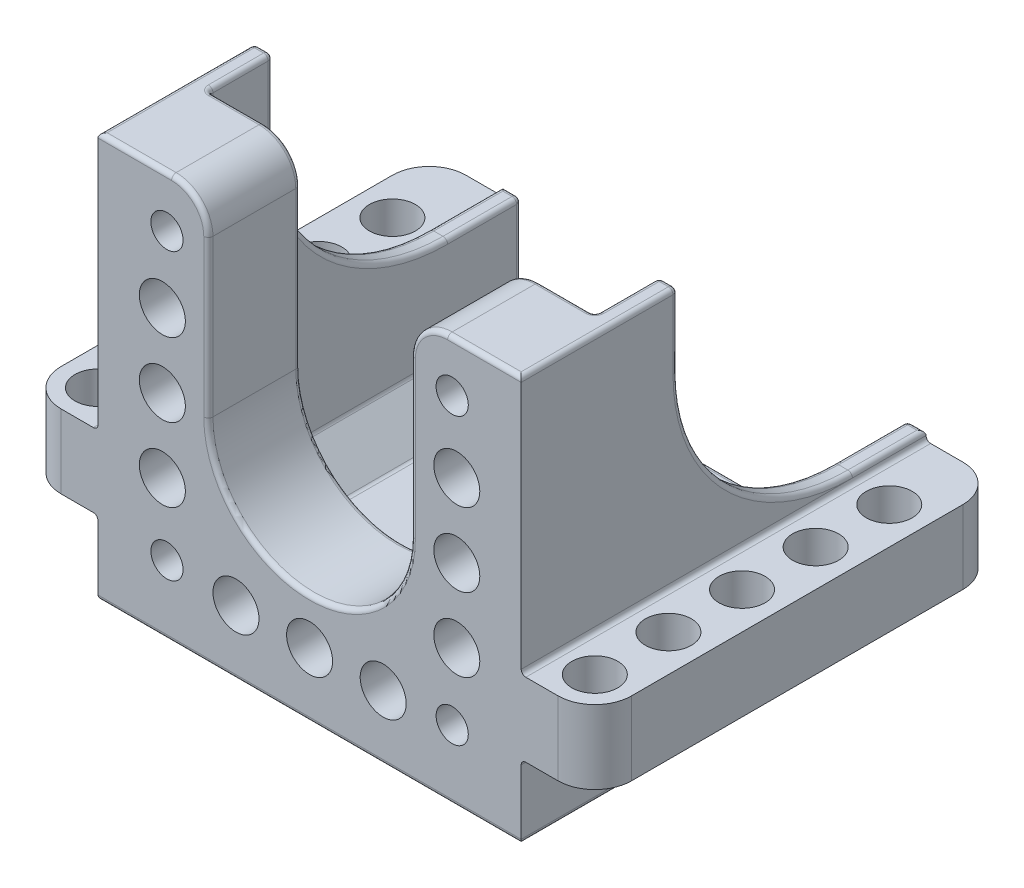
from build123d import *

# Parameters (mm, degrees)
SKETCH1_R           = 2.5
SKETCH1_R_2         = 1.75
BOSS_EXTRUDE1_DEPTH = 10
BOSS_EXTRUDE2_DEPTH = 34
CUT_EXTRUDE1_DEPTH  = 62.652250567
SKETCH3_3_W         = 44
SKETCH3_3_H         = 8
BOSS_EXTRUDE3_DEPTH = 8
SKETCH4_R           = 2.5
CUT_EXTRUDE2_DEPTH  = 54.860932038
CHAMFER1_SIZE       = 4
FILLET1_R           = 0.5
FILLET2_R           = 4


# Some blends are built 0.0001 mm under size
with BuildPart() as part:
    # Sketch1 → Boss-Extrude1 (new body)
    # profile 1 of 2: a face of its own
    with BuildSketch(Plane.XY):
        with BuildLine():
            ThreePointArc((-11, 0), (0, -11), (11, 0))
            Line((11, 0), (11, 21))
            Line((11, 21), (21, 21))
            Line((21, 21), (21, -21))
            Line((21, -21), (-21, -21))
            Line((-21, -21), (-21, 21))
            Line((-21, 21), (-11, 21))
            Line((-11, 21), (-11, 0))
        make_face()
        with Locations((-16, 8)):
            Circle(SKETCH1_R, mode=Mode.SUBTRACT)
        with Locations((-16, -8)):
            Circle(SKETCH1_R, mode=Mode.SUBTRACT)
        with Locations((-8, -16)):
            Circle(SKETCH1_R, mode=Mode.SUBTRACT)
        with Locations((8, -16)):
            Circle(SKETCH1_R, mode=Mode.SUBTRACT)
        with Locations((16, -8)):
            Circle(SKETCH1_R, mode=Mode.SUBTRACT)
        with Locations((16, 8)):
            Circle(SKETCH1_R, mode=Mode.SUBTRACT)
        with Locations((0, -16)):
            Circle(SKETCH1_R, mode=Mode.SUBTRACT)
        with Locations((-16, 0)):
            Circle(SKETCH1_R, mode=Mode.SUBTRACT)
        with Locations((16, 0)):
            Circle(SKETCH1_R, mode=Mode.SUBTRACT)
        with Locations((15.5, -15.5)):
            Circle(SKETCH1_R_2, mode=Mode.SUBTRACT)
        with Locations((15.5, 15.5)):
            Circle(SKETCH1_R_2, mode=Mode.SUBTRACT)
        with Locations((-15.5, 15.5)):
            Circle(SKETCH1_R_2, mode=Mode.SUBTRACT)
        with Locations((-15.5, -15.5)):
            Circle(SKETCH1_R_2, mode=Mode.SUBTRACT)
    # profile 2 of 2: a face of its own
    with BuildSketch(Plane.XY):
        Polygon((-23, 21), (-21, 21), (-21, -21), (21, -21), (21, 21), (23, 21), (23, -23), (-23, -23), align=None)
    extrude(amount=BOSS_EXTRUDE1_DEPTH)

    # Sketch1<3> → Boss-Extrude2 (add)
    with BuildSketch(Plane.XY):
        Polygon((-23, 21), (-21, 21), (-21, -21), (21, -21), (21, 21), (23, 21), (23, -23), (-23, -23), align=None)
    extrude(amount=-BOSS_EXTRUDE2_DEPTH)

    # Sketch3 → Cut-Extrude1 (cut, through all)
    with BuildSketch(Plane(origin=(23, 0, 0), x_dir=(0, 0, -1), z_dir=(1, 0, 0))):
        with BuildLine():
            Line((34, 21), (7, 21))
            Line((7, 21), (7, 13))
            ThreePointArc((7, 13), (12.564971157, -0.435028843), (26, -6))
            Line((26, -6), (34, -6))
            Line((34, -6), (34, 21))
        make_face()
    extrude(amount=-CUT_EXTRUDE1_DEPTH, mode=Mode.SUBTRACT)

    # Sketch3<3> → Boss-Extrude3 (add)
    with BuildSketch(Plane(origin=(23, 0, 0), x_dir=(0, 0, -1), z_dir=(1, 0, 0))):
        with Locations((12, -11)):
            Rectangle(SKETCH3_3_W, SKETCH3_3_H)
    boss_extrude3 = extrude(amount=BOSS_EXTRUDE3_DEPTH)

    # Sketch4 → Cut-Extrude2 (cut, through all)
    with BuildSketch(Plane(origin=(0, -7, 0), x_dir=(1, 0, 0), z_dir=(0, 1, 0))):
        with Locations(Location((27, -5.998987859, 0), (0, 0, 180))):
            Circle(SKETCH4_R)
        with Locations(Location((27, 2.001012141, 0), (0, 0, 180))):
            Circle(SKETCH4_R)
        with Locations(Location((27, 10.001012141, 0), (0, 0, 180))):
            Circle(SKETCH4_R)
        with Locations(Location((27, 18.001012141, 0), (0, 0, 180))):
            Circle(SKETCH4_R)
        with Locations(Location((27, 26.001012141, 0), (0, 0, 180))):
            Circle(SKETCH4_R)
    cut_extrude2 = extrude(amount=-CUT_EXTRUDE2_DEPTH, mode=Mode.SUBTRACT)

    # Mirror1: Boss-Extrude3, Cut-Extrude2 across plane
    add(boss_extrude3.mirror(Plane(origin=(0, 0, 0), x_dir=(0, 0, 1), z_dir=(1, 0, 0))))
    add(cut_extrude2.mirror(Plane(origin=(0, 0, 0), x_dir=(0, 0, 1), z_dir=(1, 0, 0))), mode=Mode.SUBTRACT)

    # Chamfer1
    chamfer1_edges = [part.edges().sort_by_distance(p)[0] for p in [
        (-21, -21, -17),
        (21, -21, -17),
    ]]
    chamfer(chamfer1_edges, length=CHAMFER1_SIZE)

    # Fillet1
    fillet1_edges = [part.edges().sort_by_distance(p)[0] for p in [
        (-21, 21, -3.5),
        (21, 21, -3.5),
        (-11, 10.5, 10),
        (0, -11, 10),
        (-11, 10.5, 0),
        (0, -11, 0),
        (-23, 17, -7),
        (-23, -6, -30),
        (-21, -6, -30),
        (-21, -0.435028843, -12.564971157),
        (23, 17, -7),
        (23, -6, -30),
        (21, 17, -7),
        (21, -6, -30),
        (0, -23, 10),
        (23, -23, -12),
        (0, -23, -34),
        (-23, -23, -12),
        (0, -21, -34),
        (0, -21, 0),
        (-21, -11.5, -34),
        (21, -11.5, -34),
        (-23, -15, -12),
        (23, -15, -12),
        (11, 10.5, 10),
        (-17, 21, 10),
        (17, 21, 10),
        (23, 21, 1.5),
        (-23, 21, 1.5),
        (-16, 21, 0),
        (16, 21, 0),
        (11, 10.5, 0),
        (-23, -7, -12),
        (23, -7, -12),
        (22, -6, -34),
        (-22, -6, -34),
        (-23, -0.435028843, -12.564971157),
        (-21, 17, -7),
        (-22, 21, -7),
        (22, 21, -7),
        (23, -0.435028843, -12.564971157),
        (21, -0.435028843, -12.564971157),
        (21, 2, 0),
        (-21, 2, 0),
        (17, -21, -17),
        (-17, -21, -17),
        (19, -19, 0),
        (21, -17, -17),
        (-19, -19, 0),
        (-21, -17, -17),
        (19, -19, -34),
        (-19, -19, -34),
    ]]
    fillet(fillet1_edges, radius=FILLET1_R - 0.0001)  # a hair under: the kernel refuses the full size

    # Fillet2
    # the kernel refuses this fillet: 4 mm, written as the material it takes off along each edge
    with BuildSketch(Plane(origin=(-15, 17, 0), x_dir=(0, 1, 0), z_dir=(-1, 0, 0))) as fillet2_piece_1:
        with BuildLine():
            CenterArc((3.5001, -0.4999), 0.4999, 0, 90)
            Line((4, -0.4999), (4, 0))
            Line((4, 0), (3.5001, 0))
        make_face()
    revolve(axis=Axis((-15, 17, 0), (0, 0, -1)), revolution_arc=90, mode=Mode.SUBTRACT)
    with BuildSketch(Plane(origin=(-15, 17, 10), x_dir=(1, 0, 0), z_dir=(0, -1, 0))) as fillet2_piece_2:
        with BuildLine():
            CenterArc((3.5001, -0.4999), 0.4999, 0, 90)
            Line((4, -0.4999), (4, 0))
            Line((4, 0), (3.5001, 0))
        make_face()
    revolve(axis=Axis((-15, 17, 10), (0, 0, 1)), revolution_arc=90, mode=Mode.SUBTRACT)
    with BuildSketch(Plane(origin=(15, 17, 0), x_dir=(-1, 0, 0), z_dir=(0, -1, 0))) as fillet2_piece_3:
        with BuildLine():
            CenterArc((3.5001, -0.4999), 0.4999, 0, 90)
            Line((4, -0.4999), (4, 0))
            Line((4, 0), (3.5001, 0))
        make_face()
    revolve(axis=Axis((15, 17, 0), (0, 0, -1)), revolution_arc=90, mode=Mode.SUBTRACT)
    with BuildSketch(Plane(origin=(15, 17, 10), x_dir=(0, 1, 0), z_dir=(1, 0, 0))) as fillet2_piece_4:
        with BuildLine():
            CenterArc((3.5001, -0.4999), 0.4999, 0, 90)
            Line((4, -0.4999), (4, 0))
            Line((4, 0), (3.5001, 0))
        make_face()
    revolve(axis=Axis((15, 17, 10), (0, 0, 1)), revolution_arc=90, mode=Mode.SUBTRACT)
    with BuildSketch(Plane(origin=(-31, -25, -34), x_dir=(0, 0, 1), z_dir=(0, 1, 0)), Plane(origin=(31, 3, 10), x_dir=(-1, 0, 0), z_dir=(0, -1, 0))) as fillet2_piece_5:
        with BuildLine():
            CenterArc((FILLET2_R, FILLET2_R), FILLET2_R, 180, 90)
            Line((0, FILLET2_R), (0, 0))
            Line((0, 0), (FILLET2_R, 0))
        make_face()
    extrude(amount=28, mode=Mode.SUBTRACT)
    with BuildSketch(Plane(origin=(-31, 3, 10), x_dir=(1, 0, 0), z_dir=(0, -1, 0)), Plane(origin=(31, -25, -34), x_dir=(0, 0, 1), z_dir=(0, 1, 0))) as fillet2_piece_6:
        with BuildLine():
            CenterArc((FILLET2_R, -FILLET2_R), FILLET2_R, 90, 90)
            Line((0, -FILLET2_R), (0, 0))
            Line((0, 0), (FILLET2_R, 0))
        make_face()
    extrude(amount=28, mode=Mode.SUBTRACT)
    with BuildSketch(Plane(origin=(11, 21, 0), x_dir=(0, -1, 0), z_dir=(0, 0, 1))) as fillet2_piece_7:
        with BuildLine():
            CenterArc((FILLET2_R, FILLET2_R), FILLET2_R, 180, 90)
            Line((0, FILLET2_R), (0, 0))
            Line((0, 0), (FILLET2_R, 0))
        make_face()
    extrude(amount=10, mode=Mode.SUBTRACT)
    with BuildSketch(Plane(origin=(-11, 21, 0), x_dir=(0, -1, 0), z_dir=(0, 0, 1))) as fillet2_piece_8:
        with BuildLine():
            CenterArc((FILLET2_R, -FILLET2_R), FILLET2_R, 90, 90)
            Line((0, -FILLET2_R), (0, 0))
            Line((0, 0), (FILLET2_R, 0))
        make_face()
    extrude(amount=10, mode=Mode.SUBTRACT)


solid = part.part
